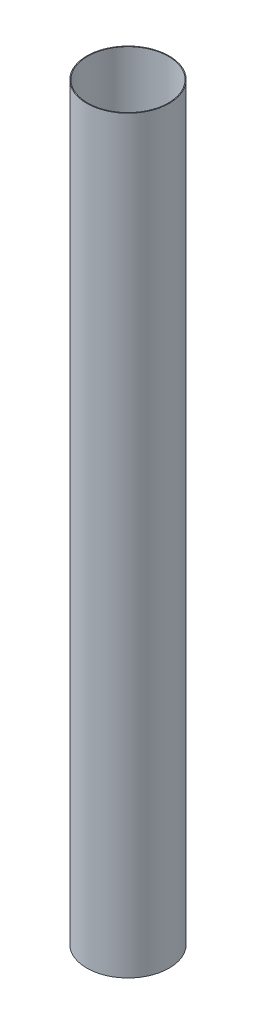
from build123d import *

# Parameters (mm, degrees)
SKETCH_1_R      = 55
SKETCH_1_R_2    = 54
EXTRUDE_1_DEPTH = 1000


with BuildPart() as part:
    # Эскиз1 → Бобышка-Вытянуть1 (new body)
    with BuildSketch(Plane(origin=(0, 0, 0), x_dir=(1, 0, 0), z_dir=(0, 1, 0))):
        Circle(SKETCH_1_R)
        Circle(SKETCH_1_R_2, mode=Mode.SUBTRACT)
    extrude(amount=EXTRUDE_1_DEPTH)


solid = part.part
